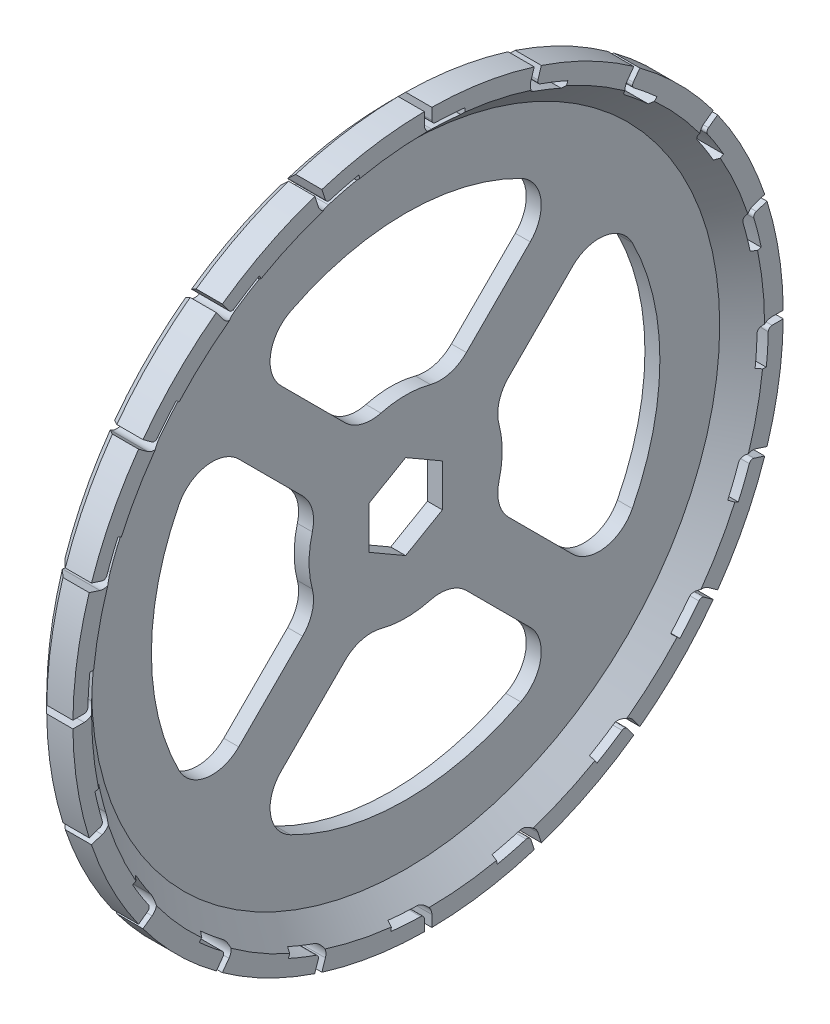
from build123d import *

# Parameters (mm, degrees)
BOSS_EXTRUDE1_DEPTH = 2
SKETCH2_R           = 45
BOSS_EXTRUDE2_DEPTH = 3
CHAMFER1_SIZE       = 3
CHAMFER2_SIZE       = 1.5
CUT_EXTRUDE2_DEPTH  = 68.362823575
CIRPATTERN1_COUNT   = 20
CUT_EXTRUDE3_DEPTH  = 3
FILLET1_R           = 5


with BuildPart() as part:
    # Sketch1 → Boss-Extrude1 (new body)
    # profile 1 of 2: a face of its own
    with BuildSketch(Plane(origin=(0, 0, 0), x_dir=(0, 0, -1), z_dir=(1, 0, 0))):
        with BuildLine():
            ThreePointArc((-0.5, 47.497368348), (0, -47.5), (0.5, 47.497368348))
            Line((0.5, 47.497368348), (0.5, 45.98912915))
            ThreePointArc((0.5, 45.98912915), (0.6426243, 45.639439847), (0.989130435, 45.489247312))
            ThreePointArc((0.989130435, 45.489247312), (2.980968693, 45.40224472), (4.967083333, 45.228067427))
            Line((4.967083333, 45.228067427), (4.857916667, 44.234043967))
            ThreePointArc((4.857916667, 44.234043967), (2.915452897, 44.404393188), (0.967391304, 44.489483634))
            ThreePointArc((0.967391304, 44.489483634), (-0.072127101, 44.940061241), (-0.5, 45.98912915))
            Line((-0.5, 45.98912915), (-0.5, 47.497368348))
        make_face()
        Polygon((-4.9125, 2.836233197), (0, 5.672466395), (4.9125, 2.836233197), (4.9125, -2.836233197), (0, -5.672466395), (-4.9125, -2.836233197), align=None, mode=Mode.SUBTRACT)
    # profile 2 of 2: a face of its own
    with BuildSketch(Plane(origin=(0, 0, 0), x_dir=(0, 0, -1), z_dir=(1, 0, 0))):
        with BuildLine():
            Line((0.5, 47.497368348), (0.5, 47.5))
            ThreePointArc((0.5, 47.5), (0, 47.502631506), (-0.5, 47.5))
            Line((-0.5, 47.5), (-0.5, 47.497368348))
            Line((-0.5, 47.497368348), (-0.5, 45.98912915))
            ThreePointArc((-0.5, 45.98912915), (-0.072127101, 44.940061241), (0.967391304, 44.489483634))
            ThreePointArc((0.967391304, 44.489483634), (2.915452897, 44.404393188), (4.857916667, 44.234043967))
            Line((4.857916667, 44.234043967), (4.967083333, 45.228067427))
            ThreePointArc((4.967083333, 45.228067427), (2.980968693, 45.40224472), (0.989130435, 45.489247312))
            ThreePointArc((0.989130435, 45.489247312), (0.6426243, 45.639439847), (0.5, 45.98912915))
            Line((0.5, 45.98912915), (0.5, 47.497368348))
        make_face()
    extrude(amount=BOSS_EXTRUDE1_DEPTH)

    # Sketch2 → Boss-Extrude2 (add)
    with BuildSketch(Plane(origin=(2, 0, 0), x_dir=(0, 0, -1), z_dir=(1, 0, 0))):
        with BuildLine():
            ThreePointArc((0.5, 47.5), (0, 47.502631506), (-0.5, 47.5))
            Line((-0.5, 47.5), (-0.5, 47.497368348))
            ThreePointArc((-0.5, 47.497368348), (0, -47.5), (0.5, 47.497368348))
            Line((0.5, 47.497368348), (0.5, 47.5))
        make_face()
        Circle(SKETCH2_R, mode=Mode.SUBTRACT)
    extrude(amount=BOSS_EXTRUDE2_DEPTH)

    # Chamfer1
    chamfer1_edges = [part.edges().sort_by_distance(p)[0] for p in [
        (2, 0, 45),
    ]]
    chamfer(chamfer1_edges, length=CHAMFER1_SIZE - 0.0001)  # a hair under: the kernel refuses the full size

    # Chamfer2
    chamfer2_edges = [part.edges().sort_by_distance(p)[0] for p in [
        (0, -47.5, 0),
    ]]
    chamfer(chamfer2_edges, length=CHAMFER2_SIZE)

    # Sketch1<4> → Cut-Extrude2 (cut, through all)
    with BuildSketch(Plane(origin=(0, 0, 0), x_dir=(0, 0, -1), z_dir=(1, 0, 0))):
        with BuildLine():
            Line((0.5, 47.497368348), (0.5, 47.5))
            ThreePointArc((0.5, 47.5), (0, 47.502631506), (-0.5, 47.5))
            Line((-0.5, 47.5), (-0.5, 47.497368348))
            Line((-0.5, 47.497368348), (-0.5, 45.98912915))
            ThreePointArc((-0.5, 45.98912915), (-0.072127101, 44.940061241), (0.967391304, 44.489483634))
            ThreePointArc((0.967391304, 44.489483634), (2.915452897, 44.404393188), (4.857916667, 44.234043967))
            Line((4.857916667, 44.234043967), (4.967083333, 45.228067427))
            ThreePointArc((4.967083333, 45.228067427), (2.980968693, 45.40224472), (0.989130435, 45.489247312))
            ThreePointArc((0.989130435, 45.489247312), (0.6426243, 45.639439847), (0.5, 45.98912915))
            Line((0.5, 45.98912915), (0.5, 47.497368348))
        make_face()
    cut_extrude2 = extrude(amount=CUT_EXTRUDE2_DEPTH, mode=Mode.SUBTRACT)

    # CirPattern1: Cut-Extrude2 ×20 about axis
    cirpattern1_axis = Axis((0, 0, 0), (1, 0, 0))
    for i in range(1, CIRPATTERN1_COUNT):
        add(cut_extrude2.rotate(cirpattern1_axis, i * 360 / CIRPATTERN1_COUNT), mode=Mode.SUBTRACT)

    # Sketch4 → Cut-Extrude3 (cut)
    with BuildSketch(Plane(origin=(2, 0, 0), x_dir=(0, 0, -1), z_dir=(1, 0, 0))):
        with BuildLine():
            ThreePointArc((-11.509805364, -5.852951114), (-12.9125, 0), (-11.509805364, 5.852951114))
            Line((-11.509805364, 5.852951114), (-11.958943437, 6.302089187))
            Line((-11.958943437, 6.302089187), (-26.703099897, 21.046245648))
            ThreePointArc((-26.703099897, 21.046245648), (-34, 0), (-26.703099897, -21.046245648))
            Line((-26.703099897, -21.046245648), (-11.958943437, -6.302089187))
            Line((-11.958943437, -6.302089187), (-11.509805364, -5.852951114))
        make_face()
        with BuildLine():
            Line((-6.302089187, 11.958943437), (-5.852951114, 11.509805364))
            ThreePointArc((-5.852951114, 11.509805364), (0, 12.9125), (5.852951114, 11.509805364))
            Line((5.852951114, 11.509805364), (6.302089187, 11.958943437))
            Line((6.302089187, 11.958943437), (21.046245648, 26.703099897))
            ThreePointArc((21.046245648, 26.703099897), (0, 34), (-21.046245648, 26.703099897))
            Line((-21.046245648, 26.703099897), (-6.302089187, 11.958943437))
        make_face()
        with BuildLine():
            Line((11.958943437, 6.302089187), (11.509805364, 5.852951114))
            ThreePointArc((11.509805364, 5.852951114), (12.556930716, 3.009343325), (12.9125, 0))
            ThreePointArc((12.9125, 0), (12.556930716, -3.009343325), (11.509805364, -5.852951114))
            Line((11.509805364, -5.852951114), (11.958943437, -6.302089187))
            Line((11.958943437, -6.302089187), (26.703099897, -21.046245648))
            ThreePointArc((26.703099897, -21.046245648), (32.12402058, -11.137652434), (34, 0))
            ThreePointArc((34, 0), (32.12402058, 11.137652434), (26.703099897, 21.046245648))
            Line((26.703099897, 21.046245648), (11.958943437, 6.302089187))
        make_face()
        with BuildLine():
            ThreePointArc((5.852951114, -11.509805364), (0, -12.9125), (-5.852951114, -11.509805364))
            Line((-5.852951114, -11.509805364), (-6.302089187, -11.958943437))
            Line((-6.302089187, -11.958943437), (-21.046245648, -26.703099897))
            ThreePointArc((-21.046245648, -26.703099897), (0, -34), (21.046245648, -26.703099897))
            Line((21.046245648, -26.703099897), (6.302089187, -11.958943437))
            Line((6.302089187, -11.958943437), (5.852951114, -11.509805364))
        make_face()
    extrude(amount=-CUT_EXTRUDE3_DEPTH, mode=Mode.SUBTRACT)

    # Fillet1
    fillet1_edges = [part.edges().sort_by_distance(p)[0] for p in [
        (1, -5.852951114, -11.509805364),
        (1, 5.852951114, -11.509805364),
        (1, 21.046245648, -26.703099897),
        (1, -21.046245648, -26.703099897),
        (1, 11.509805364, -5.852951114),
        (1, 11.509805364, 5.852951114),
        (1, 26.703099897, 21.046245648),
        (1, 26.703099897, -21.046245648),
        (1, -11.509805364, 5.852951114),
        (1, -11.509805364, -5.852951114),
        (1, -26.703099897, -21.046245648),
        (1, -26.703099897, 21.046245648),
        (1, 5.852951114, 11.509805364),
        (1, -5.852951114, 11.509805364),
        (1, -21.046245648, 26.703099897),
        (1, 21.046245648, 26.703099897),
    ]]
    fillet(fillet1_edges, radius=FILLET1_R)


solid = part.part
